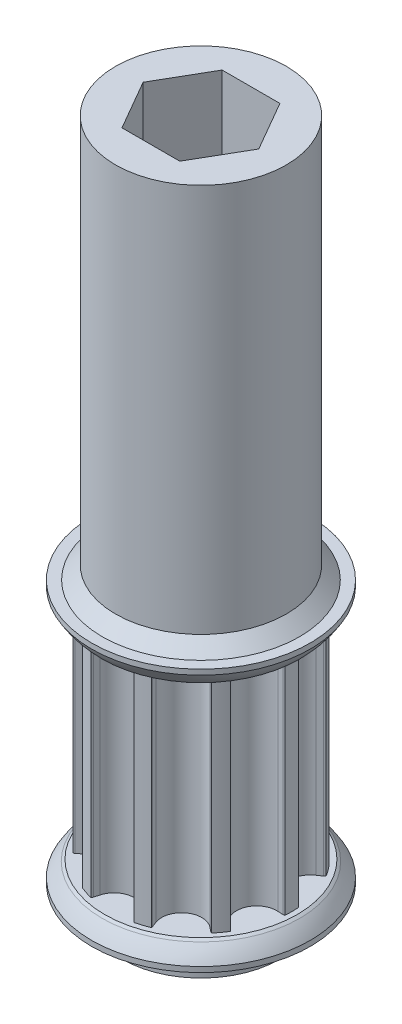
from build123d import *

# Parameters (mm, degrees)
SKETCH1_R           = 4.393648446
TOOTHOD_DEPTH       = 5.334
TOOTHPROFILE_DEPTH  = 9.189007835
TOOTHPATTERN_COUNT  = 10
BORE_DEPTH          = 10.804858556
BORE_DEPTH_BACK     = 10.804858556
SKETCH10_R          = 3.81
BOSS_EXTRUDE1_DEPTH = 1.27
SKETCH11_R          = 4.1275
BOSS_EXTRUDE2_DEPTH = 19.431
CHAMFER1_SIZE       = 0.635


with BuildPart() as part:
    # Sketch1 → ToothOD (new, symmetric)
    with BuildSketch(Plane(origin=(0, 0, 0), x_dir=(1, 0, 0), z_dir=(0, 1, 0))):
        Circle(SKETCH1_R)
    extrude(amount=TOOTHOD_DEPTH, both=True)

    # Sketch2 → ToothProfile (cut, symmetric)
    with BuildSketch(Plane(origin=(0, 0, 0), x_dir=(1, 0, 0), z_dir=(0, 1, 0))):
        with BuildLine():
            ThreePointArc((-0.937033068, 3.943710441), (-0.590385173, 3.425535831), (0, 3.225248446))
            ThreePointArc((0, 3.225248446), (0.590385173, 3.425535831), (0.937033068, 3.943710441))
            ThreePointArc((0.937033068, 3.943710441), (0.971699064, 4.069821903), (1.007805813, 4.195528446))
            ThreePointArc((1.007805813, 4.195528446), (1.021661234, 4.233200647), (1.040426249, 4.268683624))
            ThreePointArc((1.040426249, 4.268683624), (0, 4.393648446), (-1.040426249, 4.268683624))
            ThreePointArc((-1.040426249, 4.268683624), (-1.021661234, 4.233200647), (-1.007805813, 4.195528446))
            ThreePointArc((-1.007805813, 4.195528446), (-0.971699064, 4.069821903), (-0.937033068, 3.943710441))
        make_face()
    toothprofile = extrude(amount=TOOTHPROFILE_DEPTH, both=True, mode=Mode.SUBTRACT)

    # ToothPattern: ToothProfile ×10 about axis
    toothpattern_axis = Axis((0, 5.334, 0), (0, -1, 0))
    for i in range(1, TOOTHPATTERN_COUNT):
        add(toothprofile.rotate(toothpattern_axis, i * 360 / TOOTHPATTERN_COUNT), mode=Mode.SUBTRACT)

    # Sketch4 → Flange (revolve)
    with BuildSketch(Plane.XY):
        with BuildLine():
            Line((0, -5.334), (4.647648446, -5.334))
            ThreePointArc((4.647648446, -5.334), (4.711861502, -5.379341157), (4.774648446, -5.426637424))
            ThreePointArc((4.774648446, -5.426637424), (5.050690043, -5.74459066), (5.282648446, -6.096))
            Line((5.282648446, -6.096), (5.282648446, -6.35))
            Line((5.282648446, -6.35), (0, -6.35))
            Line((0, -6.35), (0, -5.334))
        make_face()
        with BuildLine():
            Line((5.282648446, 6.35), (5.282648446, 6.096))
            ThreePointArc((5.282648446, 6.096), (5.050690043, 5.74459066), (4.774648446, 5.426637424))
            ThreePointArc((4.774648446, 5.426637424), (4.711861502, 5.379341157), (4.647648446, 5.334))
            Line((4.647648446, 5.334), (0, 5.334))
            Line((0, 5.334), (0, 6.35))
            Line((0, 6.35), (5.282648446, 6.35))
        make_face()
    revolve(axis=Axis((0, 8.73125, 0), (0, -1, 0)))

    # Sketch7 → Bore (cut, two sides: drawn at the far end of the back side and taken through both)
    with BuildSketch(Plane.XZ.offset(-BORE_DEPTH_BACK)):
        Polygon((1.396812374, 2.41935), (-1.396812374, 2.41935), (-2.793624748, 0), (-1.396812374, -2.41935), (1.396812374, -2.41935), (2.793624748, 0), align=None)
    extrude(amount=BORE_DEPTH + BORE_DEPTH_BACK, mode=Mode.SUBTRACT)

    # Sketch10 → Boss-Extrude1 (add)
    with BuildSketch(Plane.XZ.offset(6.35)):
        Circle(SKETCH10_R)
        Polygon((1.396812374, 2.41935), (-1.396812374, 2.41935), (-2.793624748, 0), (-1.396812374, -2.41935), (1.396812374, -2.41935), (2.793624748, 0), align=None, mode=Mode.SUBTRACT)
    extrude(amount=BOSS_EXTRUDE1_DEPTH)

    # Sketch11 → Boss-Extrude2 (add)
    with BuildSketch(Plane(origin=(0, 6.35, 0), x_dir=(1, 0, 0), z_dir=(0, 1, 0))):
        Circle(SKETCH11_R)
        Polygon((2.793624748, 0), (1.396812374, 2.41935), (-1.396812374, 2.41935), (-2.793624748, 0), (-1.396812374, -2.41935), (1.396812374, -2.41935), align=None, mode=Mode.SUBTRACT)
    extrude(amount=BOSS_EXTRUDE2_DEPTH)

    # Chamfer1
    chamfer1_edges = [part.edges().sort_by_distance(p)[0] for p in [
        (-4.1275, 6.35, 0),
        (-3.81, -6.35, 0),
    ]]
    chamfer(chamfer1_edges, length=CHAMFER1_SIZE)


solid = part.part
